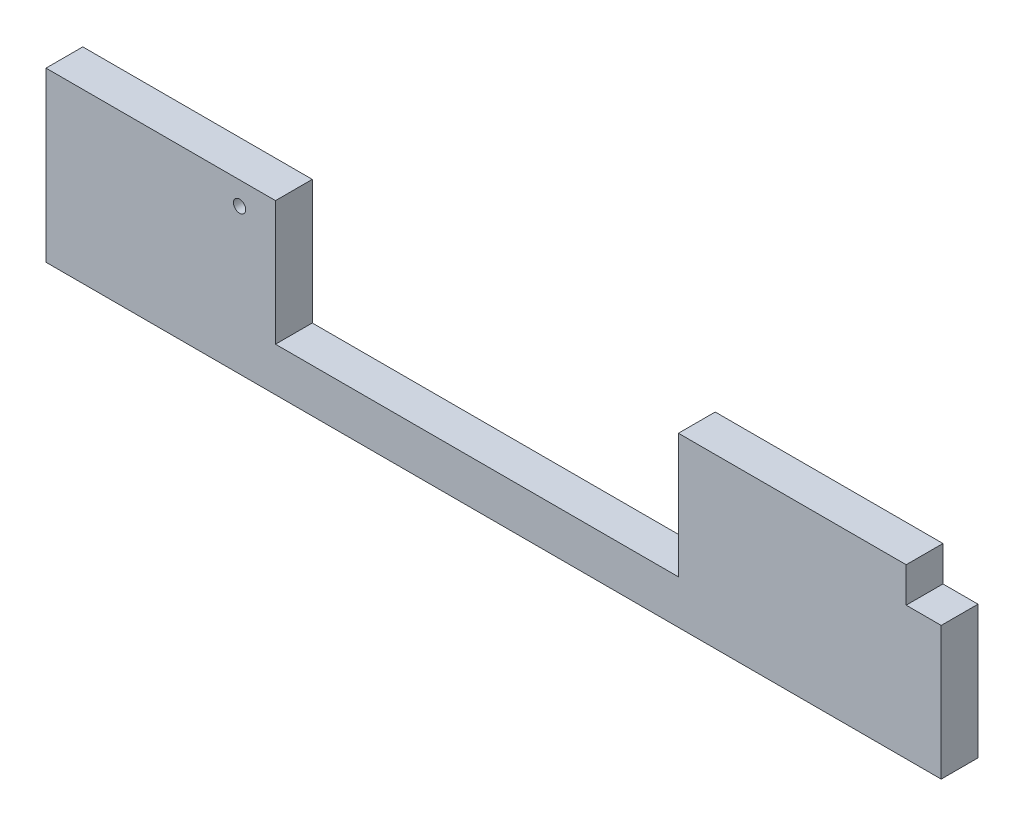
from build123d import *

# Parameters (mm, degrees)
SKETCH1_W           = 129.794
SKETCH1_H           = 24.384
BOSS_EXTRUDE1_DEPTH = 5.334
SKETCH3_W           = 58.42
SKETCH3_H           = 18.034
CUT_EXTRUDE1_DEPTH  = 104.917980915
SKETCH4_R           = 0.889
CUT_EXTRUDE2_DEPTH  = 104.917980915
SKETCH5_W           = 7.389933873
SKETCH5_H           = 9.494639421
CUT_EXTRUDE3_DEPTH  = 104.917980915


with BuildPart() as part:
    # Sketch1 → Boss-Extrude1 (new body)
    with BuildSketch(Plane.XY):
        with Locations((-20.165445418, -47.262819662)):
            Rectangle(SKETCH1_W, SKETCH1_H)
    extrude(amount=BOSS_EXTRUDE1_DEPTH)

    # Sketch3 → Cut-Extrude1 (cut, through all)
    with BuildSketch(Plane.XY.offset(5.334)):
        with Locations((-22.578445418, -44.087819662)):
            Rectangle(SKETCH3_W, SKETCH3_H)
    extrude(amount=-CUT_EXTRUDE1_DEPTH, mode=Mode.SUBTRACT)

    # Sketch4 → Cut-Extrude2 (cut, through all)
    with BuildSketch(Plane.XY.offset(5.334)):
        with Locations((-56.995445418, -38.372819662)):
            Circle(SKETCH4_R)
    extrude(amount=-CUT_EXTRUDE2_DEPTH, mode=Mode.SUBTRACT)

    # Sketch5 → Cut-Extrude3 (cut, through all)
    with BuildSketch(Plane.XY.offset(5.334)):
        with Locations((43.346521518, -35.403499952)):
            Rectangle(SKETCH5_W, SKETCH5_H)
    extrude(amount=-CUT_EXTRUDE3_DEPTH, mode=Mode.SUBTRACT)


solid = part.part
